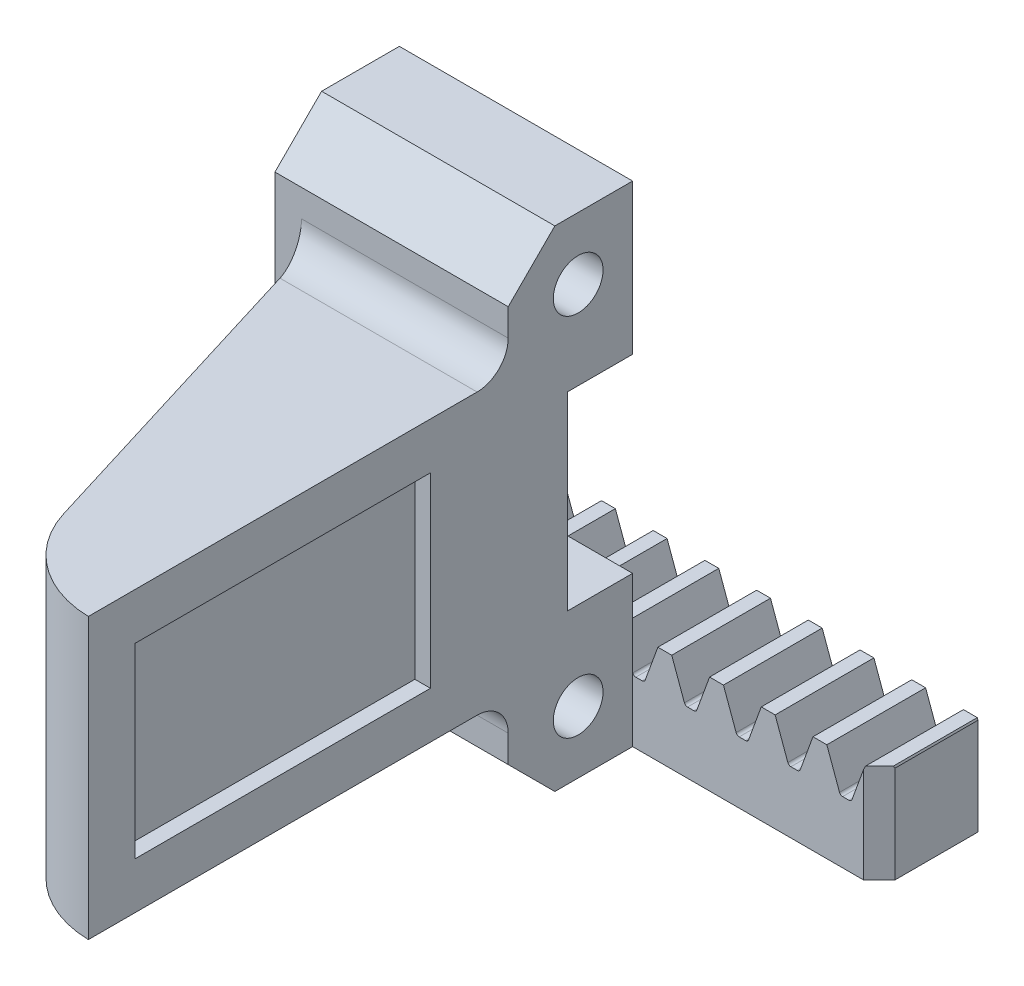
from build123d import *

# Parameters (mm, degrees)
BOSS_EXTRUDE1_DEPTH  = 18
SKETCH2_W            = 8.291454006
SKETCH2_H            = 18
BOSS_EXTRUDE2_DEPTH  = 8
SKETCH3_W            = 8
SKETCH3_H            = 18
BOSS_EXTRUDE3_DEPTH  = 1.708545994
SKETCH4_W            = 10
SKETCH4_H            = 8
BOSS_EXTRUDE4_DEPTH  = 6.75
BOSS_EXTRUDE5_DEPTH  = 5
SKETCH6_W            = 30.861
SKETCH6_H            = 6.35
BOSS_EXTRUDE6_DEPTH  = 6.35
SKETCH7_W            = 15
SKETCH7_H            = 8
BOSS_EXTRUDE7_DEPTH  = 6.75
CUT_EXTRUDE1_DEPTH   = 6.35
CUT_EXTRUDE2_DEPTH   = 6.35
BOSS_EXTRUDE8_DEPTH  = 6.35
BOSS_EXTRUDE9_DEPTH  = 6.35
BOSS_EXTRUDE10_DEPTH = 6.35
CUT_EXTRUDE3_DEPTH   = 48.596280897
CUT_EXTRUDE4_DEPTH   = 48.596280897
CUT_EXTRUDE5_DEPTH   = 48.596280897
CUT_EXTRUDE6_DEPTH   = 48.596280897
SKETCH17_W           = 4.2
SKETCH17_H           = 12.2
CUT_EXTRUDE7_DEPTH   = 51.111950381
CHAMFER1_SIZE        = 3
FILLET1_START        = -4
FILLET1_DEPTH        = 8
FILLET1_START_2      = -3.175
FILLET1_2_DEPTH      = 6.35
FILLET1_START_3      = 12.448968436
FILLET1_3_OUTLINE_W  = 5
FILLET1_3_OUTLINE_H  = 8.175
FILLET1_3_DEPTH      = 1.551031564
FILLET2_R            = 2
SKETCH20_W           = 19
SKETCH20_H           = 12
CUT_EXTRUDE8_DEPTH   = 1
SKETCH21_R           = 1.6
CUT_EXTRUDE9_DEPTH   = 51.111950381
FILLET3_R            = 7


with BuildPart() as part:
    # Sketch1 → Boss-Extrude1 (new body)
    with BuildSketch(Plane.XZ.offset(-3.575)):
        Polygon((-13.721954006, 11.175), (-5.4305, 11.175), (-5.4305, 38.175), align=None)
    extrude(amount=-BOSS_EXTRUDE1_DEPTH)

    # Sketch2 → Boss-Extrude2 (add)
    with BuildSketch(Plane(origin=(0, 0, 11.175), x_dir=(-1, 0, 0), z_dir=(0, 0, -1))):
        with Locations((9.576227003, 12.575)):
            Rectangle(SKETCH2_W, SKETCH2_H)
    extrude(amount=BOSS_EXTRUDE2_DEPTH)

    # Sketch3 → Boss-Extrude3 (add)
    with BuildSketch(Plane.ZY.offset(13.721954006)):
        with Locations((7.175, 12.575)):
            Rectangle(SKETCH3_W, SKETCH3_H)
    extrude(amount=BOSS_EXTRUDE3_DEPTH)

    # Sketch4 → Boss-Extrude4 (add)
    with BuildSketch(Plane.XZ.offset(-3.575)):
        with Locations((-10.4305, 7.175)):
            Rectangle(SKETCH4_W, SKETCH4_H)
    extrude(amount=BOSS_EXTRUDE4_DEPTH)

    # Sketch5 → Boss-Extrude5 (add)
    with BuildSketch(Plane(origin=(-5.4305, 0, 0), x_dir=(0, 0, -1), z_dir=(1, 0, 0))):
        Polygon((-3.175, 21.575), (-3.175, -3.175), (-11.175, -3.175), (-11.175, 3.575), (-38.175, 3.575), (-38.175, 21.575), align=None)
    extrude(amount=BOSS_EXTRUDE5_DEPTH)

    # Sketch6 → Boss-Extrude6 (add)
    with BuildSketch(Plane(origin=(0, 0, 3.175), x_dir=(-1, 0, 0), z_dir=(0, 0, -1))):
        Rectangle(SKETCH6_W, SKETCH6_H)
    extrude(amount=BOSS_EXTRUDE6_DEPTH)

    # Sketch7 → Boss-Extrude7 (add)
    with BuildSketch(Plane(origin=(0, 21.575, 0), x_dir=(-1, 0, 0), z_dir=(0, 1, 0))):
        with Locations((7.9305, 7.175)):
            Rectangle(SKETCH7_W, SKETCH7_H)
    extrude(amount=BOSS_EXTRUDE7_DEPTH)

    # Sketch8 → Cut-Extrude1 (cut)
    with BuildSketch(Plane(origin=(0, 0, -3.175), x_dir=(-1, 0, 0), z_dir=(0, 0, -1))):
        Polygon((1.239033663, 3.175), (-1.1938, 3.175), (-0.327866283, 0.795866667), (0.373099946, 0.795866667), align=None)
    extrude(amount=-CUT_EXTRUDE1_DEPTH, mode=Mode.SUBTRACT)

    # Sketch9 → Cut-Extrude2 (cut)
    with BuildSketch(Plane(origin=(0, 0, -3.175), x_dir=(-1, 0, 0), z_dir=(0, 0, -1))):
        Polygon((2.13106, 3.175), (2.996993717, 0.795866667), (13.672539946, 0.795866667), (14.538473663, 3.175), align=None)
    extrude(amount=-CUT_EXTRUDE2_DEPTH, mode=Mode.SUBTRACT)

    # Sketch10 → Boss-Extrude8 (add)
    with BuildSketch(Plane(origin=(0, 0, 3.175), x_dir=(-1, 0, 0), z_dir=(0, 0, -1))):
        Polygon((10.347679946, 0.795866667), (11.213613663, 3.175), (12.10564, 3.175), (12.971573717, 0.795866667), align=None)
    extrude(amount=BOSS_EXTRUDE8_DEPTH)

    # Sketch11 → Boss-Extrude9 (add)
    with BuildSketch(Plane(origin=(0, 0, 3.175), x_dir=(-1, 0, 0), z_dir=(0, 0, -1))):
        Polygon((7.022819946, 0.795866667), (7.888753663, 3.175), (8.78078, 3.175), (9.646713717, 0.795866667), align=None)
    extrude(amount=BOSS_EXTRUDE9_DEPTH)

    # Sketch12 → Boss-Extrude10 (add)
    with BuildSketch(Plane(origin=(0, 0, 3.175), x_dir=(-1, 0, 0), z_dir=(0, 0, -1))):
        Polygon((3.697959946, 0.795866667), (4.563893663, 3.175), (5.45592, 3.175), (6.321853717, 0.795866667), align=None)
    extrude(amount=BOSS_EXTRUDE10_DEPTH)

    # Sketch13 → Cut-Extrude3 (cut, through all)
    with BuildSketch(Plane.XY.offset(3.175)):
        Polygon((2.085826337, 3.175), (2.951760054, 0.795866667), (3.652726283, 0.795866667), (4.51866, 3.175), align=None)
    extrude(amount=-CUT_EXTRUDE3_DEPTH, mode=Mode.SUBTRACT)

    # Sketch14 → Cut-Extrude4 (cut, through all)
    with BuildSketch(Plane.XY.offset(3.175)):
        Polygon((5.410686337, 3.175), (6.276620054, 0.795866667), (6.977586283, 0.795866667), (7.84352, 3.175), align=None)
    extrude(amount=-CUT_EXTRUDE4_DEPTH, mode=Mode.SUBTRACT)

    # Sketch15 → Cut-Extrude5 (cut, through all)
    with BuildSketch(Plane.XY.offset(3.175)):
        Polygon((8.735546337, 3.175), (9.601480054, 0.795866667), (10.302446283, 0.795866667), (11.16838, 3.175), align=None)
    extrude(amount=-CUT_EXTRUDE5_DEPTH, mode=Mode.SUBTRACT)

    # Sketch16 → Cut-Extrude6 (cut, through all)
    with BuildSketch(Plane.XY.offset(3.175)):
        Polygon((12.060406337, 3.175), (12.926340054, 0.795866667), (13.627306283, 0.795866667), (14.49324, 3.175), align=None)
    extrude(amount=-CUT_EXTRUDE6_DEPTH, mode=Mode.SUBTRACT)

    # Sketch17 → Cut-Extrude7 (cut, through all)
    with BuildSketch(Plane(origin=(-0.4305, 0, 0), x_dir=(0, 0, -1), z_dir=(1, 0, 0))):
        with Locations((-5.275, 12.575)):
            Rectangle(SKETCH17_W, SKETCH17_H)
    extrude(amount=-CUT_EXTRUDE7_DEPTH, mode=Mode.SUBTRACT)

    # Chamfer1
    chamfer1_edges = [part.edges().sort_by_distance(p)[0] for p in [
        (-7.9305, -3.175, 11.175),
        (-7.9305, 28.325, 11.175),
    ]]
    chamfer(chamfer1_edges, length=CHAMFER1_SIZE)

    # Fillet1: read off the stored shape, not the designer's step
    # Fillet1 outline → Fillet1 (cut)
    with BuildSketch(Plane.XY.offset(FILLET1_START)):
        Polygon((15.4305, 3.175), (15.385266337, 3.175), (15.4305, 3.050721534), align=None)
    extrude(amount=FILLET1_DEPTH, mode=Mode.SUBTRACT)

    # Fillet1 2 outline → Fillet1 2 (add)
    with BuildSketch(Plane.XY.offset(FILLET1_START_2)):
        with BuildLine():
            Line((12.926340054, 0.795866667), (13.073586605, 0.795866667))
            ThreePointArc((13.073586605, 0.795866667), (12.952969292, 0.83389716), (12.875978768, 0.934233164))
            Line((12.875978768, 0.934233164), (12.926340054, 0.795866667))
        make_face()
        with BuildLine():
            Line((13.627306283, 0.795866667), (13.67766757, 0.934233164))
            ThreePointArc((13.67766757, 0.934233164), (13.600677045, 0.83389716), (13.480059732, 0.795866667))
            Line((13.480059732, 0.795866667), (13.627306283, 0.795866667))
        make_face()
        with BuildLine():
            Line((-3.697959946, 0.795866667), (-3.550713395, 0.795866667))
            ThreePointArc((-3.550713395, 0.795866667), (-3.671330708, 0.83389716), (-3.748321232, 0.934233164))
            Line((-3.748321232, 0.934233164), (-3.697959946, 0.795866667))
        make_face()
        with BuildLine():
            ThreePointArc((-2.94663243, 0.934233164), (-3.023622955, 0.83389716), (-3.144240268, 0.795866667))
            Line((-3.144240268, 0.795866667), (-2.996993717, 0.795866667))
            Line((-2.996993717, 0.795866667), (-2.94663243, 0.934233164))
        make_face()
        with BuildLine():
            Line((6.977586283, 0.795866667), (7.02794757, 0.934233164))
            ThreePointArc((7.02794757, 0.934233164), (6.950957045, 0.83389716), (6.830339732, 0.795866667))
            Line((6.830339732, 0.795866667), (6.977586283, 0.795866667))
        make_face()
        with BuildLine():
            Line((6.276620054, 0.795866667), (6.423866605, 0.795866667))
            ThreePointArc((6.423866605, 0.795866667), (6.303249292, 0.83389716), (6.226258768, 0.934233164))
            Line((6.226258768, 0.934233164), (6.276620054, 0.795866667))
        make_face()
        with BuildLine():
            Line((3.652726283, 0.795866667), (3.70308757, 0.934233164))
            ThreePointArc((3.70308757, 0.934233164), (3.626097045, 0.83389716), (3.505479732, 0.795866667))
            Line((3.505479732, 0.795866667), (3.652726283, 0.795866667))
        make_face()
        with BuildLine():
            Line((2.951760054, 0.795866667), (3.099006605, 0.795866667))
            ThreePointArc((3.099006605, 0.795866667), (2.978389292, 0.83389716), (2.901398768, 0.934233164))
            Line((2.901398768, 0.934233164), (2.951760054, 0.795866667))
        make_face()
        with BuildLine():
            Line((10.302446283, 0.795866667), (10.35280757, 0.934233164))
            ThreePointArc((10.35280757, 0.934233164), (10.275817045, 0.83389716), (10.155199732, 0.795866667))
            Line((10.155199732, 0.795866667), (10.302446283, 0.795866667))
        make_face()
        with BuildLine():
            Line((9.601480054, 0.795866667), (9.748726605, 0.795866667))
            ThreePointArc((9.748726605, 0.795866667), (9.628109292, 0.83389716), (9.551118768, 0.934233164))
            Line((9.551118768, 0.934233164), (9.601480054, 0.795866667))
        make_face()
        with BuildLine():
            Line((-6.321853717, 0.795866667), (-6.27149243, 0.934233164))
            ThreePointArc((-6.27149243, 0.934233164), (-6.348482955, 0.83389716), (-6.469100268, 0.795866667))
            Line((-6.469100268, 0.795866667), (-6.321853717, 0.795866667))
        make_face()
        with BuildLine():
            Line((-7.022819946, 0.795866667), (-6.875573395, 0.795866667))
            ThreePointArc((-6.875573395, 0.795866667), (-6.996190708, 0.83389716), (-7.073181232, 0.934233164))
            Line((-7.073181232, 0.934233164), (-7.022819946, 0.795866667))
        make_face()
        with BuildLine():
            Line((-9.646713717, 0.795866667), (-9.59635243, 0.934233164))
            ThreePointArc((-9.59635243, 0.934233164), (-9.673342955, 0.83389716), (-9.793960268, 0.795866667))
            Line((-9.793960268, 0.795866667), (-9.646713717, 0.795866667))
        make_face()
        with BuildLine():
            Line((-10.347679946, 0.795866667), (-10.200433395, 0.795866667))
            ThreePointArc((-10.200433395, 0.795866667), (-10.321050708, 0.83389716), (-10.398041232, 0.934233164))
            Line((-10.398041232, 0.934233164), (-10.347679946, 0.795866667))
        make_face()
        with BuildLine():
            ThreePointArc((0.37822757, 0.934233164), (0.301237045, 0.83389716), (0.180619732, 0.795866667))
            Line((0.180619732, 0.795866667), (0.327866283, 0.795866667))
            Line((0.327866283, 0.795866667), (0.37822757, 0.934233164))
        make_face()
        with BuildLine():
            ThreePointArc((-0.225853395, 0.795866667), (-0.346470708, 0.83389716), (-0.423461232, 0.934233164))
            Line((-0.423461232, 0.934233164), (-0.373099946, 0.795866667))
            Line((-0.373099946, 0.795866667), (-0.225853395, 0.795866667))
        make_face()
        with BuildLine():
            ThreePointArc((-12.92121243, 0.934233164), (-12.998202955, 0.83389716), (-13.118820268, 0.795866667))
            Line((-13.118820268, 0.795866667), (-12.971573717, 0.795866667))
            Line((-12.971573717, 0.795866667), (-12.92121243, 0.934233164))
        make_face()
        with BuildLine():
            ThreePointArc((-13.525293395, 0.795866667), (-13.645910708, 0.83389716), (-13.722901232, 0.934233164))
            Line((-13.722901232, 0.934233164), (-13.672539946, 0.795866667))
            Line((-13.672539946, 0.795866667), (-13.525293395, 0.795866667))
        make_face()
    extrude(amount=FILLET1_2_DEPTH)

    # Fillet1 3 outline → Fillet1 3 (cut)
    with BuildSketch(Plane(origin=(0, 0, 0), x_dir=(0.707106781186548, 0, -0.707106781186547), z_dir=(0.707106781186547, 0, 0.707106781186548)).offset(FILLET1_START_3)):
        with Locations((8.5, -0.9125)):
            Rectangle(FILLET1_3_OUTLINE_W, FILLET1_3_OUTLINE_H)
    extrude(amount=FILLET1_3_DEPTH, mode=Mode.SUBTRACT)

    # Fillet2
    fillet2_edges = [part.edges().sort_by_distance(p)[0] for p in [
        (-7.076227003, 3.575, 11.175),
        (-7.076227003, 21.575, 11.175),
    ]]
    fillet(fillet2_edges, radius=FILLET2_R)

    # Sketch20 → Cut-Extrude8 (cut)
    with BuildSketch(Plane(origin=(-0.4305, 0, 0), x_dir=(0, 0, -1), z_dir=(1, 0, 0))):
        with Locations((-25.675, 12.575)):
            Rectangle(SKETCH20_W, SKETCH20_H)
    extrude(amount=-CUT_EXTRUDE8_DEPTH, mode=Mode.SUBTRACT)

    # Sketch21 → Cut-Extrude9 (cut, symmetric)
    with BuildSketch(Plane(origin=(-0.4305, 0, 0), x_dir=(0, 0, -1), z_dir=(1, 0, 0))):
        with Locations((-6.675, 0.825)):
            Circle(SKETCH21_R)
    cut_extrude9 = extrude(amount=CUT_EXTRUDE9_DEPTH, both=True, mode=Mode.SUBTRACT)

    # Mirror1: Cut-Extrude9 across plane
    add(cut_extrude9.mirror(Plane(origin=(0, 12.575, 0), x_dir=(0, 0, 1), z_dir=(0, -1, 0))), mode=Mode.SUBTRACT)

    # Fillet3
    # the kernel refuses this fillet: 7 mm, written as the material it takes off along each edge
    with BuildSketch(Plane(origin=(-5.4305, -9.351854629, 38.175), x_dir=(1, 0, 0), z_dir=(0, 1, 0))) as fillet3_piece_1:
        with BuildLine():
            CenterArc((5.17365713, 6.997845611), FILLET3_R, 197.071245119, 71.507206098)
            Line((-1.517926116, 4.942921363), (-1.651757781, 4.901822878))
            Line((-1.651757781, 4.901822878), (-0.133831665, -0.041098485))
            Line((-0.133831665, -0.041098485), (0, -0.14))
            ThreePointArc((0, -0.14), (2.5, -0.14), (4.996526857, -0.139956912))
            Line((4.996526857, -0.139956912), (5, 0))
        make_face()
    extrude(amount=43.853709258, mode=Mode.SUBTRACT)


solid = part.part
